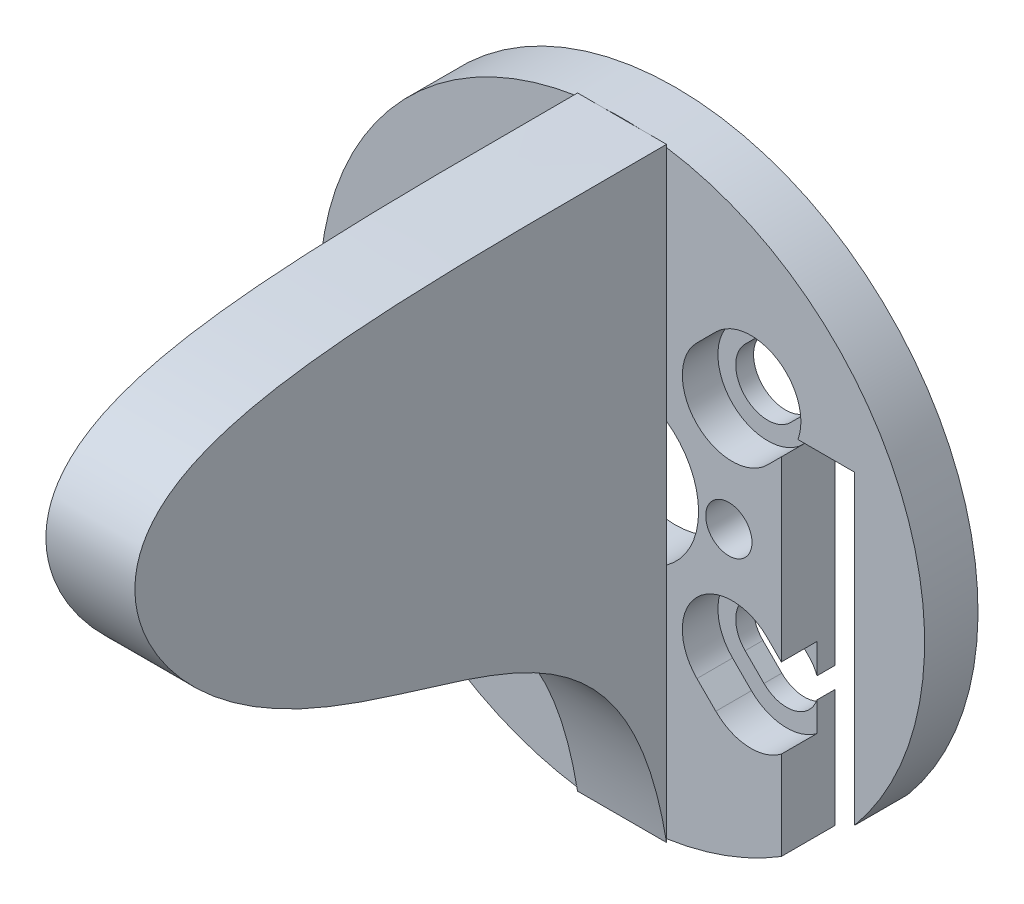
from build123d import *

# Parameters (mm, degrees)
SKETCH_2_R          = 1.3
SKETCH_2_R_2        = 4.3
EXTRUDE_1_DEPTH     = 3
CUT_EXTRUDE_1_DEPTH = 2
EXTRUDE_START       = -2.5
EXTRUDE_2_DEPTH     = 5


# Read off the part's stored shape, not the designer's step: 凸台-拉伸2
with BuildPart() as part:
    # 草图2 → 凸台-拉伸1 (new body)
    with BuildSketch(Plane.XY):
        with BuildLine():
            Line((8.95, -6.662467126), (8.95, 6.3))
            Line((8.95, 6.3), (13.05, 6.3))
            Line((13.05, 6.3), (13.05, -10.894838227))
            ThreePointArc((13.05, -10.894838227), (15.982021149, -5.794393842), (17, 0))
            ThreePointArc((17, 0), (-5.794393842, 15.982021149), (-13.05, -10.894838227))
            Line((-13.05, -10.894838227), (-13.05, 6.3))
            Line((-13.05, 6.3), (-8.95, 6.3))
            Line((-8.95, 6.3), (-8.95, -6.662467126))
            ThreePointArc((-8.95, -6.662467126), (-8.774511871, -6.294279218), (-8.520636713, -5.975052301))
            Line((-8.520636713, -5.975052301), (-7.459976542, -4.914392129))
            ThreePointArc((-7.459976542, -4.914392129), (-4.914392129, -4.914392129), (-4.914392129, -7.459976542))
            Line((-4.914392129, -7.459976542), (-5.975052301, -8.520636713))
            ThreePointArc((-5.975052301, -8.520636713), (-7.65308887, -9.001633835), (-8.95, -7.833221888))
            Line((-8.95, -7.833221888), (-8.95, -14.453286823))
            ThreePointArc((-8.95, -14.453286823), (0, -17), (8.95, -14.453286823))
            Line((8.95, -14.453286823), (8.95, -7.833221888))
            ThreePointArc((8.95, -7.833221888), (7.65308887, -9.001633835), (5.975052301, -8.520636713))
            Line((5.975052301, -8.520636713), (4.914392129, -7.459976542))
            ThreePointArc((4.914392129, -7.459976542), (4.914392129, -4.914392129), (7.459976542, -4.914392129))
            Line((7.459976542, -4.914392129), (8.520636713, -5.975052301))
            ThreePointArc((8.520636713, -5.975052301), (8.774511871, -6.294279218), (8.95, -6.662467126))
        make_face()
        with Locations((-6, 0)):
            Circle(SKETCH_2_R, mode=Mode.SUBTRACT)
        with BuildLine():
            ThreePointArc((-8.520636713, 5.975052301), (-8.520636713, 8.520636713), (-5.975052301, 8.520636713))
            Line((-5.975052301, 8.520636713), (-4.914392129, 7.459976542))
            ThreePointArc((-4.914392129, 7.459976542), (-4.914392129, 4.914392129), (-7.459976542, 4.914392129))
            Line((-7.459976542, 4.914392129), (-8.520636713, 5.975052301))
        make_face(mode=Mode.SUBTRACT)
        Circle(SKETCH_2_R_2, mode=Mode.SUBTRACT)
        with Locations((6, 0)):
            Circle(SKETCH_2_R, mode=Mode.SUBTRACT)
        with BuildLine():
            Line((4.914392129, 7.459976542), (5.975052301, 8.520636713))
            ThreePointArc((5.975052301, 8.520636713), (8.520636713, 8.520636713), (8.520636713, 5.975052301))
            Line((8.520636713, 5.975052301), (7.459976542, 4.914392129))
            ThreePointArc((7.459976542, 4.914392129), (4.914392129, 4.914392129), (4.914392129, 7.459976542))
        make_face(mode=Mode.SUBTRACT)
    extrude(amount=EXTRUDE_1_DEPTH)

    # 草图10 → 切除-拉伸1 (cut)
    with BuildSketch(Plane.XY.offset(3)):
        with BuildLine():
            Line((-5.26794552, 9.227743494), (-4.207285348, 8.167083323))
            ThreePointArc((-4.207285348, 8.167083323), (-4.207285348, 4.207285348), (-8.167083323, 4.207285348))
            Line((-8.167083323, 4.207285348), (-9.227743494, 5.26794552))
            ThreePointArc((-9.227743494, 5.26794552), (-9.227743494, 9.227743494), (-5.26794552, 9.227743494))
        make_face()
        with BuildLine():
            Line((-5.26794552, -9.227743494), (-4.207285348, -8.167083323))
            ThreePointArc((-4.207285348, -8.167083323), (-4.207285348, -4.207285348), (-8.167083323, -4.207285348))
            Line((-8.167083323, -4.207285348), (-9.227743494, -5.26794552))
            ThreePointArc((-9.227743494, -5.26794552), (-9.227743494, -9.227743494), (-5.26794552, -9.227743494))
        make_face()
        with BuildLine():
            Line((5.26794552, 9.227743494), (4.207285348, 8.167083323))
            ThreePointArc((4.207285348, 8.167083323), (4.207285348, 4.207285348), (8.167083323, 4.207285348))
            Line((8.167083323, 4.207285348), (9.227743494, 5.26794552))
            ThreePointArc((9.227743494, 5.26794552), (9.227743494, 9.227743494), (5.26794552, 9.227743494))
        make_face()
        with BuildLine():
            Line((5.26794552, -9.227743494), (4.207285348, -8.167083323))
            ThreePointArc((4.207285348, -8.167083323), (4.207285348, -4.207285348), (8.167083323, -4.207285348))
            Line((8.167083323, -4.207285348), (9.227743494, -5.26794552))
            ThreePointArc((9.227743494, -5.26794552), (9.227743494, -9.227743494), (5.26794552, -9.227743494))
        make_face()
    extrude(amount=-CUT_EXTRUDE_1_DEPTH, mode=Mode.SUBTRACT)

    # 凸台-拉伸2 outline → 凸台-拉伸2 (add)
    with BuildSketch(Plane(origin=(0, 0, 0), x_dir=(0, 0, -1), z_dir=(1, 0, 0)).offset(EXTRUDE_START)):
        with BuildLine():
            Line((-3, -17), (-3, 16.972406415))
            add(Edge.make_bspline(
                [(-3, 16.972406415), (-25.437844455, 16.972406415), (-46.151426454, 17.052198571), (-33, 11.429456716), (-30.458299322, -17), (-7.505407539, 10.413690357), (-3, -17)],
                knots=[0, 0, 0, 0, 0, 0, 0, 1, 1, 1, 1, 1, 1, 1], degree=6))
        make_face()
    extrude(amount=EXTRUDE_2_DEPTH)


solid = part.part
